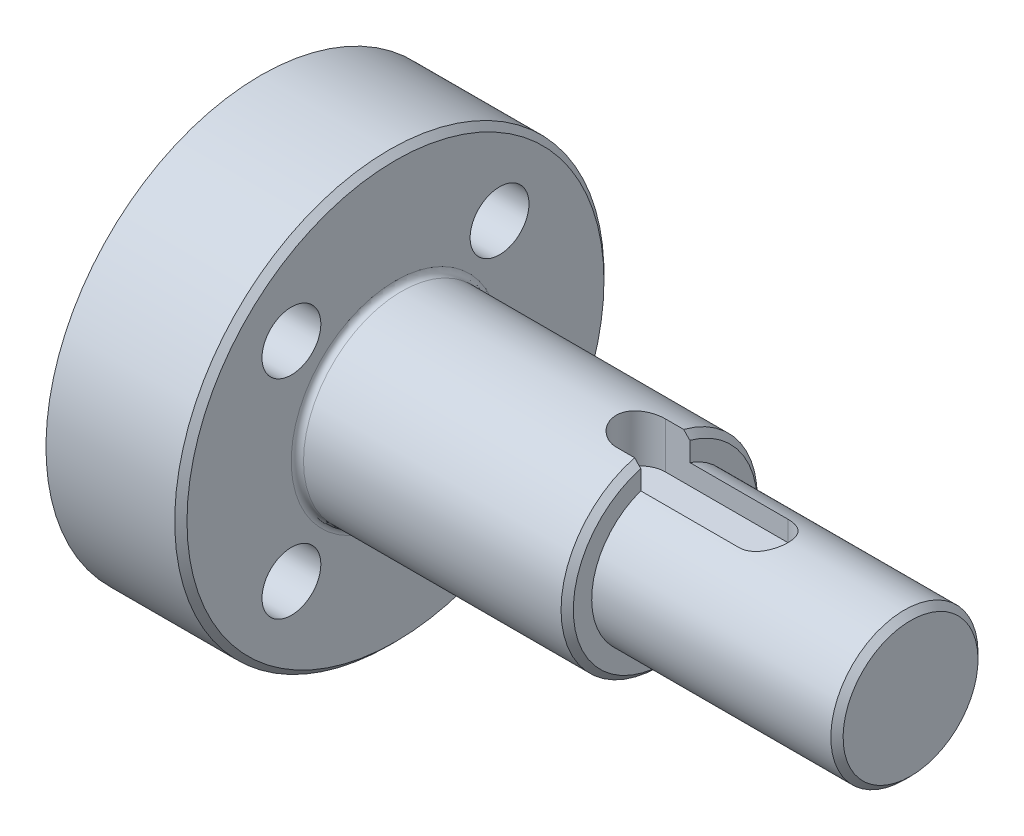
from build123d import *

# Parameters (mm, degrees)
M2_CLEARANCE_HOLE2_D = 2.4
CHAMFER2_SIZE        = 0.25
CUT_EXTRUDE1_START   = 2
CUT_EXTRUDE1_DEPTH   = 26.002314716
FILLET1_R            = 0.25


with BuildPart() as part:
    # Sketch1 → Revolve1 (revolve)
    with BuildSketch(Plane.XY):
        with BuildLine():
            Line((0, 8), (0, 0))
            Line((0, 0), (24, 0))
            Line((24, 0), (24, 3))
            Line((24, 3), (14, 3))
            Line((14, 3), (14, 4))
            Line((14, 4), (3, 4))
            Line((3, 4), (3, 8.75))
            Line((3, 8.75), (-2.5, 8.75))
            Line((-2.5, 8.75), (-2.5, 8))
            Line((-2.5, 8), (-0.75, 8))
            Line((-0.75, 8), (-0.375, 8.216506351))
            ThreePointArc((-0.375, 8.216506351), (-0.125, 8.216506351), (0, 8))
        make_face()
    revolve(axis=Axis((24, 0, 0), (-1, 0, 0)))

    # M2 Clearance Hole2 (through all)
    with Locations(Plane(origin=(3, 0, 0), x_dir=(0, 0, -1), z_dir=(1, 0, 0))):
        with Locations((4.242640687, 4.242640687), (-4.242640687, 4.242640687), (4.242640687, -4.242640687), (-4.242640687, -4.242640687)):
            Hole(M2_CLEARANCE_HOLE2_D / 2)

    # Chamfer2
    chamfer2_edges = [part.edges().sort_by_distance(p)[0] for p in [
        (14, -4, 0),
        (24, -3, 0),
        (3, -8.75, 0),
    ]]
    chamfer(chamfer2_edges, length=CHAMFER2_SIZE)

    # Sketch5 → Cut-Extrude1 (cut, through all)
    with BuildSketch(Plane(origin=(0, 0, 0), x_dir=(1, 0, 0), z_dir=(0, 1, 0)).offset(CUT_EXTRUDE1_START)):
        with BuildLine():
            Line((13, 1), (18, 1))
            ThreePointArc((18, 1), (19, 0), (18, -1))
            Line((18, -1), (13, -1))
            ThreePointArc((13, -1), (12, 0), (13, 1))
        make_face()
    extrude(amount=CUT_EXTRUDE1_DEPTH, mode=Mode.SUBTRACT)

    # Fillet1
    fillet1_edges = [part.edges().sort_by_distance(p)[0] for p in [
        (3, -4, 0),
    ]]
    fillet(fillet1_edges, radius=FILLET1_R)


solid = part.part
